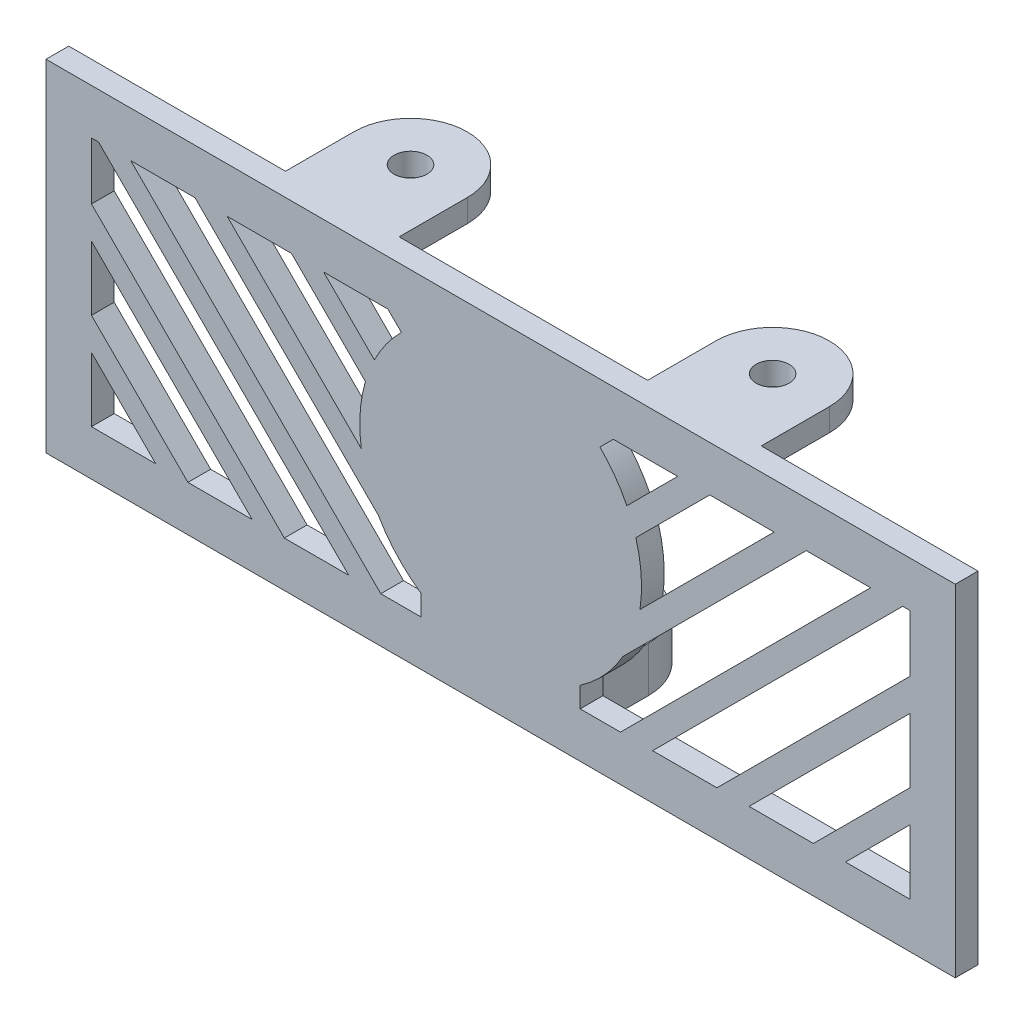
from build123d import *

# Parameters (mm, degrees)
SKETCH1_R               = 13.8795
SKETCH1_R_2             = 13.8811
SKETCH1_R_3             = 2.54
SKETCH1_W               = 163.5125
SKETCH1_H               = 30.6038
BOSS_EXTRUDE1_DEPTH     = 5.08
SKETCH3_W               = 101.6
SKETCH3_H               = 2.54
BOSS_EXTRUDE4_DEPTH     = 38.1
SKETCH7_W               = 7.620008307
SKETCH7_H               = 5.08
BOSS_EXTRUDE5_DEPTH     = 11.43
FILLET5_RADIUS          = 3.810004153
FILLET5_LENGTH          = 5.08
BOSS_EXTRUDE6_DEPTH     = 2.54
SKETCH15_R              = 1.8415
BOSS_EXTRUDE7_DEPTH     = 2.54
CUT_EXTRUDE3_START      = -5.08
SKETCH19_R              = 1.8415
CUT_EXTRUDE3_DEPTH      = 5.08
SKETCH12_W              = 155.030782426
SKETCH12_H              = 26.837151361
CUT_EXTRUDE4_DEPTH      = 229.935471644
CUT_EXTRUDE5_DEPTH      = 2.54
FILLET6_R               = 2.54
BOSS_EXTRUDE8_DEPTH     = 5.08
CUT_EXTRUDE6_DEPTH      = 186.437362631
CUT_EXTRUDE6_DEPTH_BACK = 186.437362631
SKETCH23_R              = 1.8415
SKETCH25_R              = 14.498901864
CUT_EXTRUDE7_DEPTH      = 2.54
SKETCH26_W              = 2.812159358
SKETCH26_H              = 2.54
SKETCH26_W_2            = 3.243179234
BOSS_EXTRUDE9_DEPTH     = 38.1


with BuildPart() as part:
    # Sketch1 → Boss-Extrude1 (new body)
    with BuildSketch(Plane(origin=(0, 0, 0), x_dir=(1, 0, 0), z_dir=(0, 1, 0))):
        with BuildLine():
            Line((0, 0), (201.6125, 0))
            Line((201.6125, 0), (201.6125, -45.847))
            Line((201.6125, -45.847), (166.66845, -45.847))
            Line((166.66845, -45.847), (166.66845, -83.7692))
            ThreePointArc((166.66845, -83.7692), (162.204757345, -94.545507345), (151.42845, -99.0092))
            Line((151.42845, -99.0092), (50.18405, -99.0092))
            ThreePointArc((50.18405, -99.0092), (39.407742655, -94.545507345), (34.94405, -83.7692))
            Line((34.94405, -83.7692), (34.94405, -45.847))
            Line((34.94405, -45.847), (0, -45.847))
            Line((0, -45.847), (0, 0))
        make_face()
        with Locations(Location((60.34405, -72.4265, 0), (0, 0, 270))):
            Circle(SKETCH1_R, mode=Mode.SUBTRACT)
        with Locations(Location((141.26845, -72.4281, 0), (0, 0, 270))):
            Circle(SKETCH1_R_2, mode=Mode.SUBTRACT)
        with Locations(Location((13.096875, -9.7139, 0), (0, 0, 270))):
            Circle(SKETCH1_R_3, mode=Mode.SUBTRACT)
        with Locations(Location((188.515625, -9.7139, 0), (0, 0, 270))):
            Circle(SKETCH1_R_3, mode=Mode.SUBTRACT)
        with Locations(Location((13.096875, -36.1299, 0), (0, 0, 270))):
            Circle(SKETCH1_R_3, mode=Mode.SUBTRACT)
        with Locations(Location((188.515625, -36.1299, 0), (0, 0, 270))):
            Circle(SKETCH1_R_3, mode=Mode.SUBTRACT)
        with Locations(Location((100.80625, -72.4281, 0), (0, 0, 270))):
            Circle(SKETCH1_R_2, mode=Mode.SUBTRACT)
        with Locations((100.80625, -22.9219)):
            Rectangle(SKETCH1_W, SKETCH1_H, mode=Mode.SUBTRACT)
    extrude(amount=BOSS_EXTRUDE1_DEPTH)

    # Sketch3 → Boss-Extrude4 (add)
    with BuildSketch(Plane(origin=(0, 0, 198.0184), x_dir=(-1, 0, 0), z_dir=(0, 1, 0))):
        with Locations((-100.80625, -100.2792)):
            Rectangle(SKETCH3_W, SKETCH3_H)
    extrude(amount=-BOSS_EXTRUDE4_DEPTH)

    # Sketch7 → Boss-Extrude5 (add)
    with BuildSketch(Plane(origin=(0, 0, 99.0092), x_dir=(1, 0, 0), z_dir=(0, 0, -1))):
        with Locations((100.806245847, 35.56)):
            Rectangle(SKETCH7_W, SKETCH7_H)
    extrude(amount=BOSS_EXTRUDE5_DEPTH)

    # Fillet5: full round fillet: the end face becomes a half cylinder, R = half its width
    fillet5_face = Plane((100.806245847, -35.56, 87.5792), x_dir=(0, 1, 0), z_dir=(0, 0, -1))  # on the end face: x along it, z out of the body
    fillet5_slab = fillet5_face.offset(-FILLET5_RADIUS / 2) * Box(FILLET5_LENGTH, 2 * FILLET5_RADIUS, FILLET5_RADIUS, mode=Mode.PRIVATE)  # the body's end, R deep
    fillet5_round = Plane((100.806245847, -35.56, 91.389204153), x_dir=(0, 0, -1), z_dir=(0, 1, 0)) * Cylinder(FILLET5_RADIUS, FILLET5_LENGTH, mode=Mode.PRIVATE)  # its axis R under the face
    add(fillet5_slab - fillet5_round, mode=Mode.SUBTRACT)

    # Sketch14 → Boss-Extrude6 (add)
    with BuildSketch(Plane(origin=(0, 0, 99.0092), x_dir=(-1, 0, 0), z_dir=(0, 0, -1))):
        with BuildLine():
            Line((-106.692297799, -23.852483199), (-108.165059803, -25.325245202))
            ThreePointArc((-108.165059803, -25.325245202), (-108.695299399, -24.799048835), (-109.188003193, -24.237551179))
            Line((-109.188003193, -24.237551179), (-111.016232612, -25.73340078))
            ThreePointArc((-111.016232612, -25.73340078), (-112.008576056, -24.346487635), (-112.813712744, -22.843148519))
            Line((-112.813712744, -22.843148519), (-110.663621263, -21.864835961))
            ThreePointArc((-110.663621263, -21.864835961), (-111.169570673, -20.523896068), (-111.494018753, -19.127888173))
            Line((-111.494018753, -19.127888173), (-113.825236675, -19.509217219))
            ThreePointArc((-113.825236675, -19.509217219), (-113.991174734, -17.81194348), (-113.936774001, -16.107445271))
            Line((-113.936774001, -16.107445271), (-111.585583879, -16.335247483))
            ThreePointArc((-111.585583879, -16.335247483), (-111.353278975, -14.920984767), (-110.936255307, -13.549782426))
            Line((-110.936255307, -13.549782426), (-113.145813772, -12.714414106))
            ThreePointArc((-113.145813772, -12.714414106), (-112.440883477, -11.161562901), (-111.541521956, -9.712624518))
            Line((-111.541521956, -9.712624518), (-109.619232687, -11.085502082))
            ThreePointArc((-109.619232687, -11.085502082), (-108.71091938, -9.976867094), (-107.664165119, -8.997882867))
            Line((-107.664165119, -8.997882867), (-109.160014721, -7.169653447))
            ThreePointArc((-109.160014721, -7.169653447), (-107.773101576, -6.177310003), (-106.26976246, -5.372173315))
            Line((-106.26976246, -5.372173315), (-105.291449901, -7.522264796))
            ThreePointArc((-105.291449901, -7.522264796), (-103.950510009, -7.016315387), (-102.554502114, -6.691867307))
            Line((-102.554502114, -6.691867307), (-102.93583116, -4.360649385))
            ThreePointArc((-102.93583116, -4.360649385), (-101.238557421, -4.194711325), (-99.534059212, -4.249112058))
            Line((-99.534059212, -4.249112058), (-99.761861424, -6.600302181))
            ThreePointArc((-99.761861424, -6.600302181), (-98.347598708, -6.832607085), (-96.976396367, -7.249630753))
            Line((-96.976396367, -7.249630753), (-96.141028047, -5.040072288))
            ThreePointArc((-96.141028047, -5.040072288), (-94.588176842, -5.745002582), (-93.139238459, -6.644364103))
            Line((-93.139238459, -6.644364103), (-94.512116023, -8.566653372))
            ThreePointArc((-94.512116023, -8.566653372), (-93.403481035, -9.474966679), (-92.424496807, -10.52172094))
            Line((-92.424496807, -10.52172094), (-90.596267388, -9.025871338))
            ThreePointArc((-90.596267388, -9.025871338), (-89.603923944, -10.412784483), (-88.798787256, -11.9161236))
            Line((-88.798787256, -11.9161236), (-90.948878737, -12.894436158))
            ThreePointArc((-90.948878737, -12.894436158), (-90.442929327, -14.23537605), (-90.118481247, -15.631383945))
            Line((-90.118481247, -15.631383945), (-87.787263325, -15.250054899))
            ThreePointArc((-87.787263325, -15.250054899), (-87.621325266, -16.947328638), (-87.675725999, -18.651826847))
            Line((-87.675725999, -18.651826847), (-90.026916121, -18.424024635))
            ThreePointArc((-90.026916121, -18.424024635), (-90.261418035, -19.847693028), (-90.683092324, -21.227553033))
            Line((-90.683092324, -21.227553033), (-88.475027465, -22.066861331))
            ThreePointArc((-88.475027465, -22.066861331), (-89.182726542, -23.618452644), (-90.084671181, -25.065784483))
            Line((-90.084671181, -25.065784483), (-92.004508517, -23.689480212))
            ThreePointArc((-92.004508517, -23.689480212), (-92.446198552, -24.26398978), (-92.925321338, -24.807674144))
            Line((-92.925321338, -24.807674144), (-94.354515121, -23.023521367))
            ThreePointArc((-94.354515121, -23.023521367), (-93.409906556, -21.784451479), (-92.300984022, -20.689978846))
            Line((-92.300984022, -20.689978846), (-92.300984022, -12.009378674))
            ThreePointArc((-92.300984022, -12.009378674), (-96.99616691, -10.159066764), (-100.80625, -6.84973702))
            ThreePointArc((-100.80625, -6.84973702), (-104.633502919, -10.130984342), (-109.311759392, -12.009378674))
            Line((-109.311759392, -12.009378674), (-109.311759392, -20.689978846))
            ThreePointArc((-109.311759392, -20.689978846), (-107.900903874, -22.187470719), (-106.692297799, -23.852483199))
        make_face()
        with BuildLine():
            Line((-100.80625, -23.220768427), (-99.599369927, -22.380573493))
            Line((-99.599369927, -22.380573493), (-99.599369927, -18.3831432))
            Line((-99.599369927, -18.3831432), (-94.428037288, -16.022579614))
            Line((-94.428037288, -16.022579614), (-95.257330485, -18.716255471))
            Line((-95.257330485, -18.716255471), (-98.169049816, -19.087499686))
            Line((-98.169049816, -19.087499686), (-98.169049816, -30.877249674))
            Line((-98.169049816, -30.877249674), (-98.113370072, -30.877249674))
            ThreePointArc((-98.113370072, -30.877249674), (-96.397994117, -25.717029016), (-93.380333496, -21.193300875))
            Line((-93.380333496, -21.193300875), (-93.380333496, -12.307821257))
            ThreePointArc((-93.380333496, -12.307821257), (-97.539082277, -10.495406691), (-100.80625, -7.348081946))
            ThreePointArc((-100.80625, -7.348081946), (-104.073417723, -10.495406691), (-108.232166504, -12.307821257))
            Line((-108.232166504, -12.307821257), (-108.232166504, -21.193300875))
            ThreePointArc((-108.232166504, -21.193300875), (-105.214505883, -25.717029016), (-103.499129928, -30.877249674))
            Line((-103.499129928, -30.877249674), (-103.443450184, -30.877249674))
            Line((-103.443450184, -30.877249674), (-103.443450184, -19.087499686))
            Line((-103.443450184, -19.087499686), (-106.355169515, -18.716255471))
            Line((-106.355169515, -18.716255471), (-107.184462712, -16.022579614))
            Line((-107.184462712, -16.022579614), (-102.013130073, -18.3831432))
            Line((-102.013130073, -18.3831432), (-102.013130073, -22.380573493))
            Line((-102.013130073, -22.380573493), (-100.80625, -23.220768427))
        make_face()
    extrude(amount=-BOSS_EXTRUDE6_DEPTH)

    # Sketch15 → Boss-Extrude7 (add)
    # profile 1 of 2: a face of its own
    with BuildSketch(Plane.XZ):
        with BuildLine():
            Line((114.68735, 88.8492), (114.68735, 96.4692))
            Line((114.68735, 96.4692), (127.38735, 96.4692))
            Line((127.38735, 96.4692), (127.38735, 88.8492))
            ThreePointArc((127.38735, 88.8492), (121.03735, 82.4992), (114.68735, 88.8492))
        make_face()
        with Locations(Location((121.03735, 88.8492, 0), (0, 0, 270))):
            Circle(SKETCH15_R, mode=Mode.SUBTRACT)
    # profile 2 of 2: a face of its own
    with BuildSketch(Plane.XZ):
        with BuildLine():
            Line((74.22515, 96.4692), (86.92515, 96.4692))
            Line((86.92515, 96.4692), (86.92515, 88.8492))
            ThreePointArc((86.92515, 88.8492), (80.57515, 82.4992), (74.22515, 88.8492))
            Line((74.22515, 88.8492), (74.22515, 96.4692))
        make_face()
        with Locations(Location((80.57515, 88.8492, 0), (0, 0, 90))):
            Circle(SKETCH15_R, mode=Mode.SUBTRACT)
    extrude(amount=BOSS_EXTRUDE7_DEPTH)

    # Sketch19 → Cut-Extrude3 (cut)
    with BuildSketch(Plane.XZ.offset(CUT_EXTRUDE3_START)):
        with Locations(Location((80.57515, 88.8492, 0), (0, 0, 90))):
            Circle(SKETCH19_R)
        with Locations(Location((121.03735, 88.8492, 0), (0, 0, 270))):
            Circle(SKETCH19_R)
    extrude(amount=CUT_EXTRUDE3_DEPTH, mode=Mode.SUBTRACT)

    # Sketch12 → Cut-Extrude4 (cut, through all)
    with BuildSketch(Plane(origin=(201.6125, 0, 0), x_dir=(0, 0, -1), z_dir=(1, 0, 0))):
        with Locations((-77.515391213, 13.418575681)):
            Rectangle(SKETCH12_W, SKETCH12_H)
    extrude(amount=-CUT_EXTRUDE4_DEPTH, mode=Mode.SUBTRACT)

    # Sketch21 → Cut-Extrude5 (cut)
    with BuildSketch(Plane.XY.offset(99.0092)):
        Polygon((55.08625, -33.02), (55.08625, -25.835795103), (62.270454897, -33.02), align=None)
        Polygon((55.08625, -5.08), (55.883069587, -5.08), (83.823069587, -33.02), (76.638864691, -33.02), (55.08625, -11.467385309), align=None)
        with BuildLine():
            Line((91.916241693, -33.02), (91.916241693, -30.737077601))
            ThreePointArc((91.916241693, -30.737077601), (89.237970167, -28.421401444), (87.1450505, -25.565673567))
            Line((87.1450505, -25.565673567), (66.659376933, -5.08))
            Line((66.659376933, -5.08), (59.475172036, -5.08))
            Line((59.475172036, -5.08), (87.415172036, -33.02))
            Line((87.415172036, -33.02), (91.916241693, -33.02))
        make_face()
        Polygon((146.52625, -5.08), (145.729430413, -5.08), (117.789430413, -33.02), (124.973635309, -33.02), (146.52625, -11.467385309), align=None)
        with BuildLine():
            Line((109.69625, -33.02), (114.197327964, -33.02))
            Line((114.197327964, -33.02), (142.137327964, -5.08))
            Line((142.137327964, -5.08), (134.953123067, -5.08))
            Line((134.953123067, -5.08), (114.4674495, -25.565673567))
            ThreePointArc((114.4674495, -25.565673567), (112.374526421, -28.421405143), (109.69625, -30.737083287))
            Line((109.69625, -30.737083287), (109.69625, -33.02))
        make_face()
        Polygon((146.52625, -33.02), (146.52625, -25.835795103), (139.342045103, -33.02), align=None)
        Polygon((135.749942655, -33.02), (146.52625, -22.243692655), (146.52625, -15.059487758), (128.565737758, -33.02), align=None)
        with BuildLine():
            Line((124.176815722, -5.08), (115.916182775, -13.340632947))
            ThreePointArc((115.916182775, -13.340632947), (116.509577502, -16.678871551), (116.374281129, -20.06673949))
            Line((116.374281129, -20.06673949), (131.361020619, -5.08))
            Line((131.361020619, -5.08), (124.176815722, -5.08))
        make_face()
        with BuildLine():
            Line((120.584713274, -5.08), (114.907893678, -10.756819596))
            ThreePointArc((114.907893678, -10.756819596), (113.575134343, -8.545454533), (111.89877754, -6.581730837))
            Line((111.89877754, -6.581730837), (113.400508377, -5.08))
            Line((113.400508377, -5.08), (120.584713274, -5.08))
        make_face()
        Polygon((65.862557345, -33.02), (55.08625, -22.243692655), (55.08625, -15.059487758), (73.046762242, -33.02), align=None)
        with BuildLine():
            Line((70.251479381, -5.08), (85.238218871, -20.06673949))
            ThreePointArc((85.238218871, -20.06673949), (85.102922498, -16.678871551), (85.696317225, -13.340632947))
            Line((85.696317225, -13.340632947), (77.435684278, -5.08))
            Line((77.435684278, -5.08), (70.251479381, -5.08))
        make_face()
        with BuildLine():
            Line((81.027786726, -5.08), (86.704606322, -10.756819596))
            ThreePointArc((86.704606322, -10.756819596), (88.037365657, -8.545454533), (89.71372246, -6.581730837))
            Line((89.71372246, -6.581730837), (88.211991623, -5.08))
            Line((88.211991623, -5.08), (81.027786726, -5.08))
        make_face()
    extrude(amount=-CUT_EXTRUDE5_DEPTH, mode=Mode.SUBTRACT)

    # Fillet6
    fillet6_edges = [part.edges().sort_by_distance(p)[0] for p in [
        (151.60625, -19.05, 99.0092),
        (50.00625, -19.05, 99.0092),
    ]]
    fillet(fillet6_edges, radius=FILLET6_R - 0.0001)  # a hair under: the kernel refuses the full size

    # Sketch22 → Boss-Extrude8 (add)
    with BuildSketch(Plane(origin=(0, -33.02, 0), x_dir=(1, 0, 0), z_dir=(0, 1, 0))):
        with BuildLine():
            Line((94.45625, -96.4692), (94.45625, -88.8492))
            ThreePointArc((94.45625, -88.8492), (100.80625, -82.4992), (107.15625, -88.8492))
            Line((107.15625, -88.8492), (107.15625, -96.4692))
            Line((107.15625, -96.4692), (94.45625, -96.4692))
        make_face()
    extrude(amount=-BOSS_EXTRUDE8_DEPTH)

    # Sketch23 → Cut-Extrude6 (cut, two sides: drawn at the far end of the back side and taken through both)
    with BuildSketch(Plane(origin=(0, -33.02, 0), x_dir=(1, 0, 0), z_dir=(0, 1, 0)).offset(-CUT_EXTRUDE6_DEPTH_BACK)):
        with Locations(Location((100.80625, -88.8492, 0), (0, 0, 270))):
            Circle(SKETCH23_R)
    extrude(amount=CUT_EXTRUDE6_DEPTH + CUT_EXTRUDE6_DEPTH_BACK, mode=Mode.SUBTRACT)

    # Sketch25 → Cut-Extrude7 (cut)
    with BuildSketch(Plane.XY.offset(99.0092)):
        with Locations((100.80625, -17.748386051)):
            Circle(SKETCH25_R)
    extrude(amount=CUT_EXTRUDE7_DEPTH, mode=Mode.SUBTRACT)

    # Sketch26 → Boss-Extrude9 (add)
    with BuildSketch(Plane(origin=(0, 0, 0), x_dir=(1, 0, 0), z_dir=(0, 1, 0))):
        with Locations((51.412329679, -97.7392)):
            Rectangle(SKETCH26_W, SKETCH26_H)
        with Locations((149.984660383, -97.7392)):
            Rectangle(SKETCH26_W_2, SKETCH26_H)
    extrude(amount=-BOSS_EXTRUDE9_DEPTH)


solid = part.part
